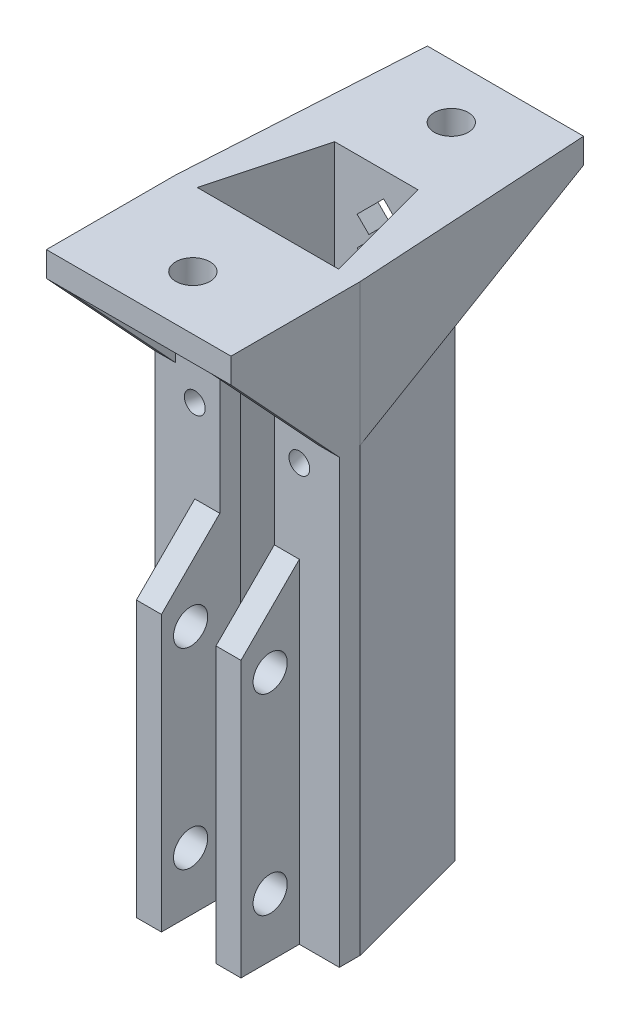
from build123d import *

# Parameters (mm, degrees)
BOSS_EXTRUDE1_DEPTH      = 40
SKETCH3_R                = 2.05
CUT_EXTRUDE2_DEPTH       = 40
BOSS_EXTRUDE2_DEPTH      = 30
SKETCH16_R               = 1.25
CUT_EXTRUDE9_DEPTH       = 3.5
SKETCH17_R               = 1.25
CUT_EXTRUDE10_DEPTH      = 3.5
SKETCH18_W               = 22.143059906
SKETCH18_H               = 3
BOSS_EXTRUDE4_DEPTH      = 15.5
BOSS_EXTRUDE5_DEPTH      = 13
BOSS_EXTRUDE5_DEPTH_BACK = 2
SKETCH19_W               = 13.83663494
SKETCH19_H               = 3
BOSS_EXTRUDE6_DEPTH      = 2.5
BOSS_EXTRUDE8_DEPTH      = 2.5
BOSS_EXTRUDE9_DEPTH      = 4.2
BOSS_EXTRUDE10_DEPTH     = 4.2
SKETCH25_R               = 2.05
CUT_EXTRUDE12_DEPTH      = 3.5
CUT_EXTRUDE13_DEPTH      = 71.528016285
CUT_EXTRUDE14_DEPTH      = 71.528016285
SKETCH29_W               = 6.543059906
SKETCH29_H               = 2.5
BOSS_EXTRUDE12_DEPTH     = 12
CUT_EXTRUDE15_DEPTH      = 78.526546191
FILLET1_R                = 1
CUT_EXTRUDE16_DEPTH      = 18


with BuildPart() as part:
    # Sketch2 → Boss-Extrude1 (new body)
    with BuildSketch(Plane(origin=(0, 0, 0), x_dir=(1, 0, 0), z_dir=(0, 1, 0))):
        Polygon((5.768335638, 3.843580014), (-8.068299302, 3.843580014), (-12.221511785, -11.656419986), (-12.221511785, -14.156419986), (-7.421511785, -14.156419986), (-7.421511785, -21.156419986), (-4.421511785, -21.156419986), (-4.421511785, -11.656419986), (-9.633321334, -11.656419986), (-6.149981832, 1.343580014), (3.850018168, 1.343580014), (7.33335767, -11.656419986), (2.121548121, -11.656419986), (2.121548121, -21.156419986), (5.121548121, -21.156419986), (5.121548121, -14.156419986), (9.921548121, -14.156419986), (9.921548121, -11.656419986), align=None)
    extrude(amount=BOSS_EXTRUDE1_DEPTH)

    # Sketch3 → Cut-Extrude2 (cut)
    with BuildSketch(Plane.ZY.offset(7.421511785)):
        with Locations((17.656419986, 30)):
            Circle(SKETCH3_R)
        with Locations((17.656419986, 7)):
            Circle(SKETCH3_R)
    extrude(amount=-CUT_EXTRUDE2_DEPTH, mode=Mode.SUBTRACT)

    # Sketch4 → Boss-Extrude2 (add)
    with BuildSketch(Plane(origin=(0, 40, 0), x_dir=(1, 0, 0), z_dir=(0, 1, 0))):
        Polygon((-4.421511785, -11.656419986), (-9.633321334, -11.656419986), (-6.149981832, 1.343580014), (3.850018168, 1.343580014), (7.33335767, -11.656419986), (2.121548121, -11.656419986), (2.121548121, -14.156419986), (5.121548121, -14.156419986), (9.921548121, -14.156419986), (9.921548121, -11.656419986), (5.768335638, 3.843580014), (-8.068299302, 3.843580014), (-12.221511785, -11.656419986), (-12.221511785, -14.156419986), (-7.421511785, -14.156419986), (-4.421511785, -14.156419986), align=None)
    extrude(amount=BOSS_EXTRUDE2_DEPTH)

    # Sketch16 → Cut-Extrude9 (cut, along a direction that is not the sketch's normal)
    with BuildSketch(Plane.XY.offset(14.156419986)):
        with Locations((-7.421511785, 50)):
            Circle(SKETCH16_R)
    extrude(amount=-CUT_EXTRUDE9_DEPTH, dir=(-0.2588190451025246, 0, 0.9659258262890672), mode=Mode.SUBTRACT)

    # Sketch17 → Cut-Extrude10 (cut, along a direction that is not the sketch's normal)
    with BuildSketch(Plane.XY.offset(14.156419986)):
        with Locations((5.121548121, 50)):
            Circle(SKETCH17_R)
    extrude(amount=-CUT_EXTRUDE10_DEPTH, dir=(0.25881904510251796, 0, 0.9659258262890691), mode=Mode.SUBTRACT)

    # Sketch18 → Boss-Extrude4 (add)
    with BuildSketch(Plane(origin=(0, 0, 11.656419986), x_dir=(-1, 0, 0), z_dir=(0, 0, -1))):
        with Locations((1.149981832, 68.5)):
            Rectangle(SKETCH18_W, SKETCH18_H)
    extrude(amount=-BOSS_EXTRUDE4_DEPTH)

    # Sketch19 → Boss-Extrude5 (add, two sides: drawn at the far end of the back side and taken through both)
    with BuildSketch(Plane(origin=(0, 0, -3.843580014), x_dir=(-1, 0, 0), z_dir=(0, 0, -1)).offset(-BOSS_EXTRUDE5_DEPTH_BACK)):
        with Locations((1.149981832, 68.5)):
            Rectangle(SKETCH19_W, SKETCH19_H)
    extrude(amount=BOSS_EXTRUDE5_DEPTH + BOSS_EXTRUDE5_DEPTH_BACK)

    # Sketch21 → Boss-Extrude6 (add)
    with BuildSketch(Plane.ZY.offset(12.221511785)):
        Polygon((27.156419986, 67), (14.156419986, 53), (14.156419986, 67), align=None)
    extrude(amount=-BOSS_EXTRUDE6_DEPTH)

    # Sketch22 → Boss-Extrude8 (add)
    with BuildSketch(Plane(origin=(9.921548121, 0, 0), x_dir=(0, 0, -1), z_dir=(1, 0, 0))):
        Polygon((-27.156419986, 67), (-14.156419986, 67), (-14.156419986, 53), align=None)
    extrude(amount=-BOSS_EXTRUDE8_DEPTH)

    # Sketch23 → Boss-Extrude9 (add)
    with BuildSketch(Plane(origin=(9.921548121, 0, 0), x_dir=(0, 0, -1), z_dir=(1, 0, 0))):
        Polygon((-11.656419986, 70), (-11.656419986, 53), (16.843580014, 67), (16.843580014, 70), align=None)
    extrude(amount=-BOSS_EXTRUDE9_DEPTH)

    # Sketch24 → Boss-Extrude10 (add)
    with BuildSketch(Plane.ZY.offset(12.221511785)):
        Polygon((11.656419986, 70), (-16.843580014, 70), (-16.843580014, 67), (11.656419986, 53), align=None)
    extrude(amount=-BOSS_EXTRUDE10_DEPTH)

    # Sketch25 → Cut-Extrude12 (cut)
    with BuildSketch(Plane(origin=(0, 70, 0), x_dir=(1, 0, 0), z_dir=(0, 1, 0))):
        with Locations((-1.149981694, 10.343580014)):
            Circle(SKETCH25_R)
        with Locations((-1.149981723, -20.656419986)):
            Circle(SKETCH25_R)
    extrude(amount=-CUT_EXTRUDE12_DEPTH, mode=Mode.SUBTRACT)

    # Sketch26 → Cut-Extrude13 (cut, through all, along a direction that is not the sketch's normal)
    with BuildSketch(Plane(origin=(0, 47.309855268, 23.239928904), x_dir=(-1, 0, 0), z_dir=(-4.742047126241555e-14, -0.8975543264374147, -0.4409038796534669))):
        Polygon((-5.721548121, 12.905635433), (-7.33335767, 12.905635433), (-5.721548121, 19.607575306), align=None)
        Polygon((8.021511785, 12.905635433), (8.021511785, 19.607575306), (9.633321334, 12.905635433), align=None)
    extrude(amount=-CUT_EXTRUDE13_DEPTH, dir=(0, -1, 0), mode=Mode.SUBTRACT)

    # Sketch27 → Cut-Extrude14 (cut, through all, along a direction that is not the sketch's normal)
    with BuildSketch(Plane(origin=(0, 47.309855268, 23.239928904), x_dir=(-1, 0, 0), z_dir=(0, -0.8975543264374147, -0.440903879653467))):
        Polygon((12.221511785, 12.905635433), (10.521511785, 44.658588051), (12.221511785, 44.658588051), align=None)
        Polygon((-9.921548121, 12.905635433), (-9.921548121, 44.658588051), (-8.221548121, 44.658588051), align=None)
    extrude(amount=-CUT_EXTRUDE14_DEPTH, dir=(0, -1, 0), mode=Mode.SUBTRACT)

    # Sketch29 → Boss-Extrude12 (add)
    with BuildSketch(Plane.XZ.offset(-67)):
        with Locations((-1.149981832, 12.906419986)):
            Rectangle(SKETCH29_W, SKETCH29_H)
    extrude(amount=BOSS_EXTRUDE12_DEPTH)

    # Sketch30 → Cut-Extrude15 (cut, through all)
    with BuildSketch(Plane.XY.offset(14.156419986)):
        Polygon((-0.266128308, 67), (-3.448108823, 63.818019485), (-2.033895261, 62.403805922), (1.148085254, 65.585786438), align=None)
        Polygon((-3.448108823, 60.318019485), (-2.033895261, 58.903805922), (1.148085254, 62.085786438), (-0.266128308, 63.5), align=None)
        Polygon((-3.448108823, 56.818019485), (-2.033895261, 55.403805922), (1.148085254, 58.585786438), (-0.266128308, 60), align=None)
    extrude(amount=-CUT_EXTRUDE15_DEPTH, mode=Mode.SUBTRACT)

    # Fillet1
    fillet1_edges = [part.edges().sort_by_distance(p)[0] for p in [
        (-4.421511785, 55, 12.906419986),
        (2.121548121, 55, 12.906419986),
    ]]
    fillet(fillet1_edges, radius=FILLET1_R)

    # Sketch31 → Cut-Extrude16 (cut)
    with BuildSketch(Plane(origin=(5.121548121, 0, 0), x_dir=(0, 0, -1), z_dir=(1, 0, 0))):
        Polygon((-14.156419986, 40), (-21.156419986, 40), (-21.156419986, 33), align=None)
    extrude(amount=-CUT_EXTRUDE16_DEPTH, mode=Mode.SUBTRACT)


solid = part.part
